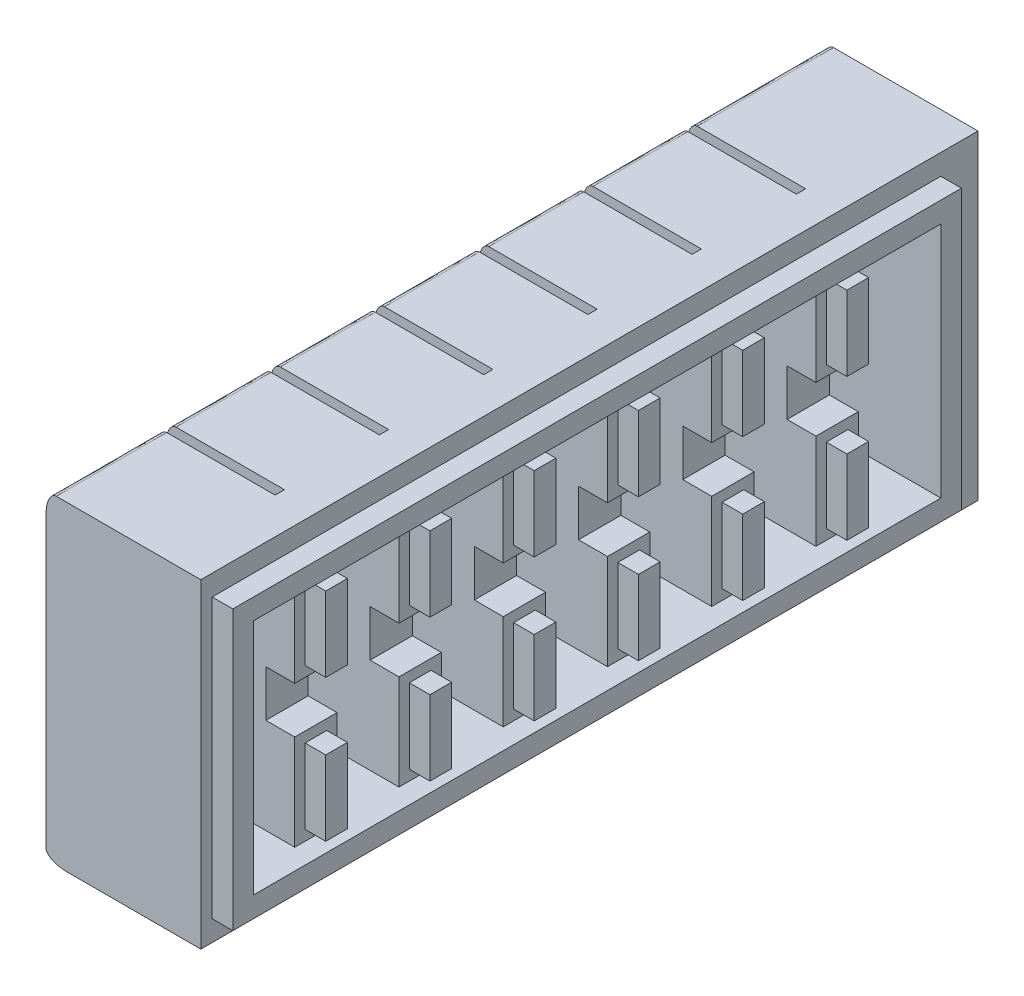
from build123d import *

# Parameters (mm, degrees)
SKETCH1_W           = 9.2
SKETCH1_H           = 31
SKETCH1_W_2         = 6
SKETCH1_H_2         = 23
BOSS_EXTRUDE1_DEPTH = 13
SKETCH1_2_W         = 9.2
SKETCH1_2_H         = 31
SKETCH1_2_W_2       = 6
SKETCH1_2_H_2       = 23
BOSS_EXTRUDE2_DEPTH = 2
SKETCH2_W           = 3.5
SKETCH2_H           = 31
BOSS_EXTRUDE3_DEPTH = 2
FILLET1_R           = 1
LPATTERN1_COUNT     = 7
LPATTERN1_PITCH     = 10.1
SKETCH4_W           = 15
SKETCH4_H           = 31
BOSS_EXTRUDE5_DEPTH = 4
SKETCH6_W           = 15
SKETCH6_H           = 31
BOSS_EXTRUDE6_DEPTH = 1.5
SKETCH5_W           = 60.6
SKETCH5_H           = 4.5
CUT_EXTRUDE1_DEPTH  = 2.8
SKETCH7_W           = 70.6
SKETCH7_H           = 27
SKETCH7_W_2         = 66.6
SKETCH7_H_2         = 23
BOSS_EXTRUDE7_DEPTH = 2
SKETCH8_W           = 2.1
SKETCH8_H           = 7.25
BOSS_EXTRUDE8_DEPTH = 2
FILLET3_SIZE        = 1
FILLET3_SIZE_2      = 2


with BuildPart() as part:
    # Sketch1 → Boss-Extrude1 (new body)
    with BuildSketch(Plane(origin=(0, 0, 0), x_dir=(0, 0, -1), z_dir=(1, 0, 0))):
        with Locations((-4.6, 15.5)):
            Rectangle(SKETCH1_W, SKETCH1_H)
        with Locations((-4.6, 15.5)):
            Rectangle(SKETCH1_W_2, SKETCH1_H_2, mode=Mode.SUBTRACT)
    extrude(amount=BOSS_EXTRUDE1_DEPTH)

    # Sketch1<2> → Boss-Extrude2 (add)
    # profile 1 of 2: a face of its own
    with BuildSketch(Plane(origin=(0, 0, 0), x_dir=(0, 0, -1), z_dir=(1, 0, 0))):
        with Locations((-4.6, 15.5)):
            Rectangle(SKETCH1_2_W, SKETCH1_2_H)
        with Locations((-4.6, 15.5)):
            Rectangle(SKETCH1_2_W_2, SKETCH1_2_H_2, mode=Mode.SUBTRACT)
    # profile 2 of 2: a face of its own
    with BuildSketch(Plane(origin=(0, 0, 0), x_dir=(0, 0, -1), z_dir=(1, 0, 0))):
        with Locations((-4.6, 15.5)):
            Rectangle(SKETCH1_2_W_2, SKETCH1_2_H_2)
    extrude(amount=-BOSS_EXTRUDE2_DEPTH)

    # Sketch2 → Boss-Extrude3 (add)
    with BuildSketch(Plane(origin=(0, 0, 0), x_dir=(-1, 0, 0), z_dir=(0, 0, -1))):
        with Locations((-11.25, 15.5)):
            Rectangle(SKETCH2_W, SKETCH2_H)
    extrude(amount=BOSS_EXTRUDE3_DEPTH)

    # Fillet1
    fillet1_edges = [part.edges().sort_by_distance(p)[0] for p in [
        (0, 4, 4.6),
        (0, 15.5, 1.6),
        (0, 27, 4.6),
        (0, 15.5, 7.6),
    ]]
    fillet(fillet1_edges, radius=FILLET1_R)


with BuildPart() as lpattern1_1:
    # LPattern1: pattern copy
    add(part.part.moved(Location(Vector(0, 0, -1) * (1 * LPATTERN1_PITCH))))


with BuildPart() as lpattern1_2:
    # LPattern1: pattern copy
    add(part.part.moved(Location(Vector(0, 0, -1) * (2 * LPATTERN1_PITCH))))


with BuildPart() as lpattern1_3:
    # LPattern1: pattern copy
    add(part.part.moved(Location(Vector(0, 0, -1) * (3 * LPATTERN1_PITCH))))


with BuildPart() as lpattern1_4:
    # LPattern1: pattern copy
    add(part.part.moved(Location(Vector(0, 0, -1) * (4 * LPATTERN1_PITCH))))


with BuildPart() as lpattern1_5:
    # LPattern1: pattern copy
    add(part.part.moved(Location(Vector(0, 0, -1) * (5 * LPATTERN1_PITCH))))


with BuildPart() as lpattern1_6:
    # LPattern1: pattern copy
    add(part.part.moved(Location(Vector(0, 0, -1) * (6 * LPATTERN1_PITCH))))


with BuildPart() as lpattern1_3_1:
    add(lpattern1_3.part)

    # Combine1: union LPattern1_4, LPattern1_5, LPattern1_6, LPattern1_1, LPattern1_2, part
    add(lpattern1_4.part)
    add(lpattern1_5.part)
    add(lpattern1_6.part)
    add(lpattern1_1.part)
    add(lpattern1_2.part)
    add(part.part)

    # Sketch4 → Boss-Extrude5 (add)
    with BuildSketch(Plane(origin=(0, 0, -60.6), x_dir=(-1, 0, 0), z_dir=(0, 0, -1))):
        with Locations((-5.5, 15.5)):
            Rectangle(SKETCH4_W, SKETCH4_H)
    extrude(amount=BOSS_EXTRUDE5_DEPTH)

    # Sketch6 → Boss-Extrude6 (add)
    with BuildSketch(Plane.XY.offset(9.2)):
        with Locations((5.5, 15.5)):
            Rectangle(SKETCH6_W, SKETCH6_H)
    extrude(amount=BOSS_EXTRUDE6_DEPTH)

    # Sketch5 → Cut-Extrude1 (cut)
    with BuildSketch(Plane(origin=(13, 0, 0), x_dir=(0, 0, -1), z_dir=(1, 0, 0))):
        with Locations((28.7, 15.5)):
            Rectangle(SKETCH5_W, SKETCH5_H)
    extrude(amount=-CUT_EXTRUDE1_DEPTH, mode=Mode.SUBTRACT)

    # Sketch7 → Boss-Extrude7 (add)
    with BuildSketch(Plane(origin=(13, 0, 0), x_dir=(0, 0, -1), z_dir=(1, 0, 0))):
        with Locations((25.7, 15.5)):
            Rectangle(SKETCH7_W, SKETCH7_H)
        with Locations((25.7, 15.5)):
            Rectangle(SKETCH7_W_2, SKETCH7_H_2, mode=Mode.SUBTRACT)
    extrude(amount=BOSS_EXTRUDE7_DEPTH)

    # Sketch8 → Boss-Extrude8 (add)
    with BuildSketch(Plane(origin=(13, 0, 0), x_dir=(0, 0, -1), z_dir=(1, 0, 0))):
        with Locations((50.95, 22.375)):
            Rectangle(SKETCH8_W, SKETCH8_H)
        with Locations((0.45, 8.625)):
            Rectangle(SKETCH8_W, SKETCH8_H)
        with Locations((0.45, 22.375)):
            Rectangle(SKETCH8_W, SKETCH8_H)
        with Locations((10.55, 8.625)):
            Rectangle(SKETCH8_W, SKETCH8_H)
        with Locations((10.55, 22.375)):
            Rectangle(SKETCH8_W, SKETCH8_H)
        with Locations((20.65, 8.625)):
            Rectangle(SKETCH8_W, SKETCH8_H)
        with Locations((20.65, 22.375)):
            Rectangle(SKETCH8_W, SKETCH8_H)
        with Locations((30.75, 8.625)):
            Rectangle(SKETCH8_W, SKETCH8_H)
        with Locations((30.75, 22.375)):
            Rectangle(SKETCH8_W, SKETCH8_H)
        with Locations((40.85, 8.625)):
            Rectangle(SKETCH8_W, SKETCH8_H)
        with Locations((40.85, 22.375)):
            Rectangle(SKETCH8_W, SKETCH8_H)
        with Locations((50.95, 8.625)):
            Rectangle(SKETCH8_W, SKETCH8_H)
    extrude(amount=BOSS_EXTRUDE8_DEPTH)

    # Fillet3
    # a fillet whose section is not a circle: 2, 1 mm, written as the material it takes off along each edge
    with BuildSketch(Plane(origin=(-2, 31, -6), x_dir=(1, 0, 0), z_dir=(0, 0, -1)), Plane(origin=(-2, 31, 4.1), x_dir=(1, 0, 0), z_dir=(0, 0, -1)), Plane(origin=(-2, 31, -16.1), x_dir=(1, 0, 0), z_dir=(0, 0, -1)), Plane(origin=(-2, 31, -36.3), x_dir=(1, 0, 0), z_dir=(0, 0, -1)), Plane(origin=(-2, 31, -26.2), x_dir=(1, 0, 0), z_dir=(0, 0, -1))) as fillet3_piece_1:
        with BuildLine():
            Bezier((FILLET3_SIZE, 0), (0, 0), (0, FILLET3_SIZE_2), weights=[1, 0.707106781, 1])
            Line((0, FILLET3_SIZE_2), (0, 0))
            Line((0, 0), (FILLET3_SIZE, 0))
        make_face()
    extrude(amount=19.2, mode=Mode.SUBTRACT)
    with BuildSketch(Plane(origin=(-2, 31, -5), x_dir=(1, 0, 0), z_dir=(0, 0, 1))) as fillet3_piece_2:
        with BuildLine():
            Bezier((FILLET3_SIZE, 0), (0, 0), (0, -FILLET3_SIZE_2), weights=[1, 0.707106781, 1])
            Line((0, -FILLET3_SIZE_2), (0, 0))
            Line((0, 0), (FILLET3_SIZE, 0))
        make_face()
    extrude(amount=20.7, mode=Mode.SUBTRACT)
    with BuildSketch(Plane(origin=(-2, 0, -15.1), x_dir=(1, 0, 0), z_dir=(0, 0, 1)), Plane(origin=(-2, 0, -25.2), x_dir=(1, 0, 0), z_dir=(0, 0, 1)), Plane(origin=(-2, 0, -35.3), x_dir=(1, 0, 0), z_dir=(0, 0, 1)), Plane(origin=(-2, 0, -45.4), x_dir=(1, 0, 0), z_dir=(0, 0, 1)), Plane(origin=(-2, 0, -55.5), x_dir=(1, 0, 0), z_dir=(0, 0, 1))) as fillet3_piece_3:
        with BuildLine():
            Bezier((FILLET3_SIZE_2, 0), (0, 0), (0, FILLET3_SIZE), weights=[1, 0.707106781, 1])
            Line((0, FILLET3_SIZE), (0, 0))
            Line((0, 0), (FILLET3_SIZE_2, 0))
        make_face()
    extrude(amount=19.2, mode=Mode.SUBTRACT)
    with BuildSketch(Plane(origin=(-2, 0, 15.7), x_dir=(1, 0, 0), z_dir=(0, 0, -1))) as fillet3_piece_4:
        with BuildLine():
            Bezier((FILLET3_SIZE_2, 0), (0, 0), (0, -FILLET3_SIZE), weights=[1, 0.707106781, 1])
            Line((0, -FILLET3_SIZE), (0, 0))
            Line((0, 0), (FILLET3_SIZE_2, 0))
        make_face()
    extrude(amount=20.7, mode=Mode.SUBTRACT)
    with BuildSketch(Plane(origin=(-2, 31, -69.6), x_dir=(1, 0, 0), z_dir=(0, 0, 1))) as fillet3_piece_5:
        with BuildLine():
            Bezier((FILLET3_SIZE, 0), (0, 0), (0, -FILLET3_SIZE_2), weights=[1, 0.707106781, 1])
            Line((0, -FILLET3_SIZE_2), (0, 0))
            Line((0, 0), (FILLET3_SIZE, 0))
        make_face()
    extrude(amount=23.2, mode=Mode.SUBTRACT)
    with BuildSketch(Plane(origin=(-2, 0, -46.4), x_dir=(1, 0, 0), z_dir=(0, 0, -1))) as fillet3_piece_6:
        with BuildLine():
            Bezier((FILLET3_SIZE_2, 0), (0, 0), (0, -FILLET3_SIZE), weights=[1, 0.707106781, 1])
            Line((0, -FILLET3_SIZE), (0, 0))
            Line((0, 0), (FILLET3_SIZE_2, 0))
        make_face()
    extrude(amount=23.2, mode=Mode.SUBTRACT)


solid = lpattern1_3_1.part
